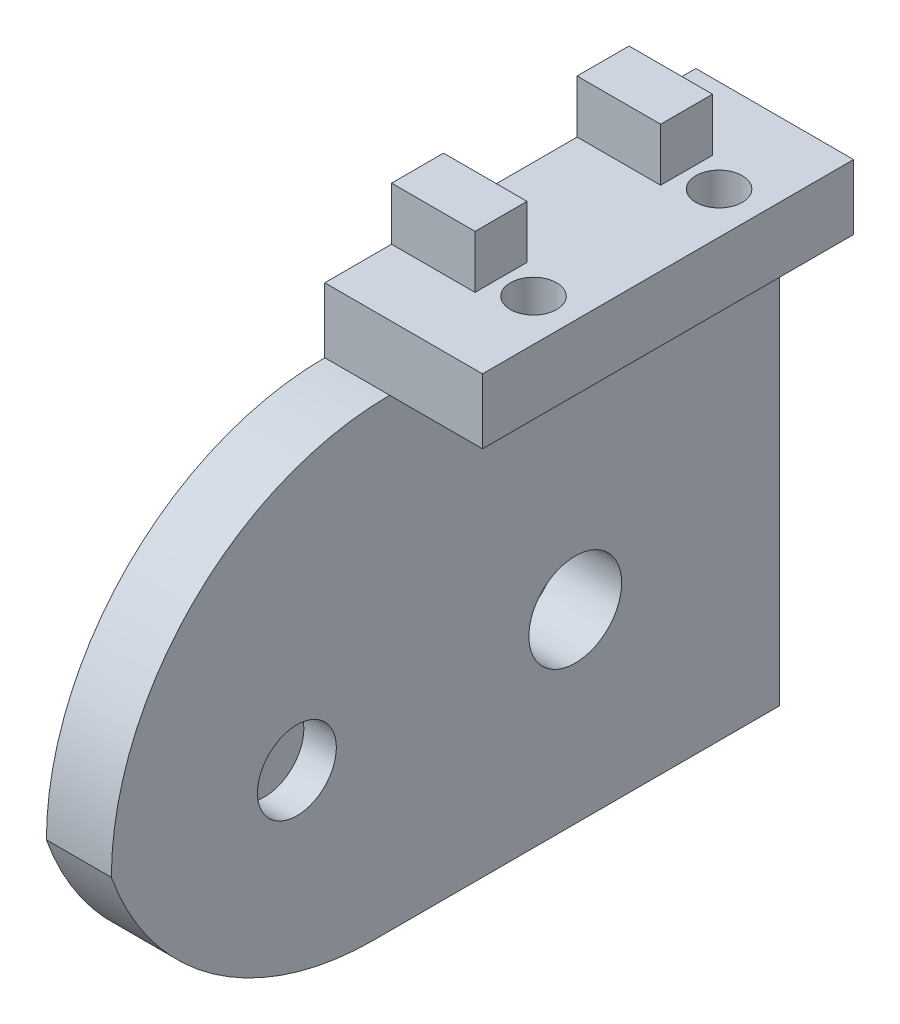
from build123d import *

# Parameters (mm, degrees)
CROQUIS1_W              = 40
CROQUIS1_H              = 40
SALIENTE_EXTRUIR1_DEPTH = 7
CROQUIS3_W              = 5.6
CROQUIS3_H              = 5.7
SALIENTE_EXTRUIR3_DEPTH = 40
CROQUIS19_W             = 8
CROQUIS19_H             = 40
CORTAR_EXTRUIR5_DEPTH   = 5.7
CROQUIS20_R             = 2.5
CORTAR_EXTRUIR6_DEPTH   = 7
CROQUIS21_W             = 7
CROQUIS21_H             = 72
SALIENTE_EXTRUIR4_DEPTH = 50
CROQUIS22_R             = 5
CORTAR_EXTRUIR7_DEPTH   = 7
CROQUIS25_R             = 4.25
CORTAR_EXTRUIR8_DEPTH   = 3.5
REDONDEO1_R             = 30
REDONDEO2_R             = 30
CROQUIS29_W             = 103.753326912
CROQUIS29_H             = 179.412983462
CORTAR_EXTRUIR9_DEPTH   = 23


# Some blends are built 0.0001 mm under size
with BuildPart() as part:
    # Croquis1 → Saliente-Extruir1 (new body)
    with BuildSketch(Plane(origin=(0, 0, 0), x_dir=(1, 0, 0), z_dir=(0, 1, 0))):
        Rectangle(CROQUIS1_W, CROQUIS1_H)
    extrude(amount=SALIENTE_EXTRUIR1_DEPTH)

    # Croquis3 → Saliente-Extruir3 (add)
    with BuildSketch(Plane.ZY.offset(20)):
        with Locations((10, 9.85)):
            Rectangle(CROQUIS3_W, CROQUIS3_H)
        with Locations((-10, 9.85)):
            Rectangle(CROQUIS3_W, CROQUIS3_H)
    extrude(amount=-SALIENTE_EXTRUIR3_DEPTH)

    # Croquis19 → Cortar-Extruir5 (cut)
    with BuildSketch(Plane(origin=(0, 12.7, 0), x_dir=(1, 0, 0), z_dir=(0, 1, 0))):
        with Locations((-16, 0)):
            Rectangle(CROQUIS19_W, CROQUIS19_H)
        with Locations((16, 0)):
            Rectangle(CROQUIS19_W, CROQUIS19_H)
    extrude(amount=-CORTAR_EXTRUIR5_DEPTH, mode=Mode.SUBTRACT)

    # Croquis20 → Cortar-Extruir6 (cut)
    with BuildSketch(Plane(origin=(0, 7, 0), x_dir=(1, 0, 0), z_dir=(0, 1, 0))):
        with Locations(Location((-15.5, 10, 0), (0, 0, 270))):
            Circle(CROQUIS20_R)
        with Locations(Location((15.5, 10, 0), (0, 0, 270))):
            Circle(CROQUIS20_R)
        with Locations(Location((15.5, -10, 0), (0, 0, 270))):
            Circle(CROQUIS20_R)
        with Locations(Location((-15.5, -10, 0), (0, 0, 270))):
            Circle(CROQUIS20_R)
    extrude(amount=-CORTAR_EXTRUIR6_DEPTH, mode=Mode.SUBTRACT)

    # Croquis21 → Saliente-Extruir4 (add)
    with BuildSketch(Plane.XZ):
        with Locations((6.5, 14)):
            Rectangle(CROQUIS21_W, CROQUIS21_H)
    extrude(amount=SALIENTE_EXTRUIR4_DEPTH)

    # Croquis22 → Cortar-Extruir7 (cut)
    with BuildSketch(Plane(origin=(10, 0, 0), x_dir=(0, 0, -1), z_dir=(1, 0, 0))):
        with Locations((0, -30)):
            Circle(CROQUIS22_R)
    extrude(amount=-CORTAR_EXTRUIR7_DEPTH, mode=Mode.SUBTRACT)

    # Croquis25 → Cortar-Extruir8 (cut)
    with BuildSketch(Plane(origin=(10, 0, 0), x_dir=(0, 0, -1), z_dir=(1, 0, 0))):
        with Locations((-30, -30)):
            Circle(CROQUIS25_R)
    extrude(amount=-CORTAR_EXTRUIR8_DEPTH, mode=Mode.SUBTRACT)

    # Redondeo1
    redondeo1_edges = [part.edges().sort_by_distance(p)[0] for p in [
        (6.5, 0, 50),
    ]]
    fillet(redondeo1_edges, radius=REDONDEO1_R - 0.0001)  # a hair under: the kernel refuses the full size

    # Redondeo2
    # the kernel refuses this fillet: 30 mm, written as the material it takes off along each edge
    with BuildSketch(Plane(origin=(80.710766507, -50, 50), x_dir=(0, 1, 0), z_dir=(-1, 0, 0))) as redondeo2_piece_1:
        with BuildLine():
            CenterArc((30, 28.284306603), REDONDEO2_R, 180, 70.528981937)
            Line((0, 28.284306603), (-0.6, 28.284306603))
            Line((-0.6, 28.284306603), (-0.6, 0))
            Line((-0.6, 0), (0, -0.6))
            ThreePointArc((0, -0.6), (10.00005, -0.6), (19.800102, -0.565686132))
            Line((19.800102, -0.565686132), (20.0001, 0))
        make_face()
    extrude(amount=148.421533013, mode=Mode.SUBTRACT)

    # Croquis29 → Cortar-Extruir9 (cut)
    with BuildSketch(Plane.ZY.offset(20)):
        Rectangle(CROQUIS29_W, CROQUIS29_H)
    extrude(amount=-CORTAR_EXTRUIR9_DEPTH, mode=Mode.SUBTRACT)


solid = part.part
